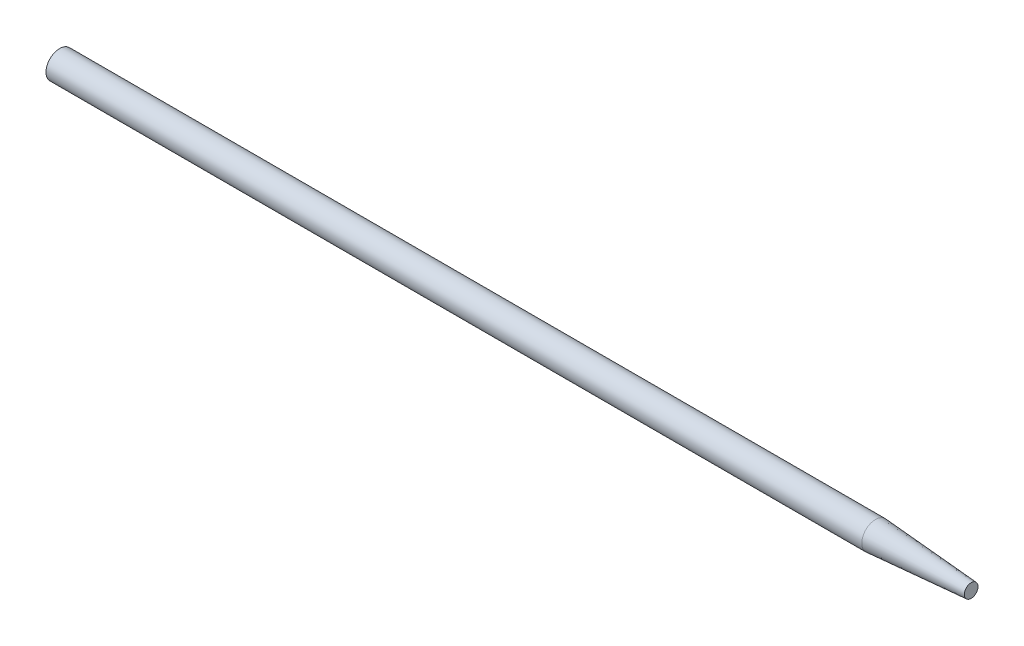
from build123d import *


with BuildPart() as part:
    # Çizim1 → Döndür1 (revolve)
    with BuildSketch(Plane.XY):
        Polygon((500, 3.75), (447.506701238, 7.5), (0, 7.5), (0, 0), (500, 0), align=None)
    revolve(axis=Axis((0, 0, 0), (1, 0, 0)))


solid = part.part
